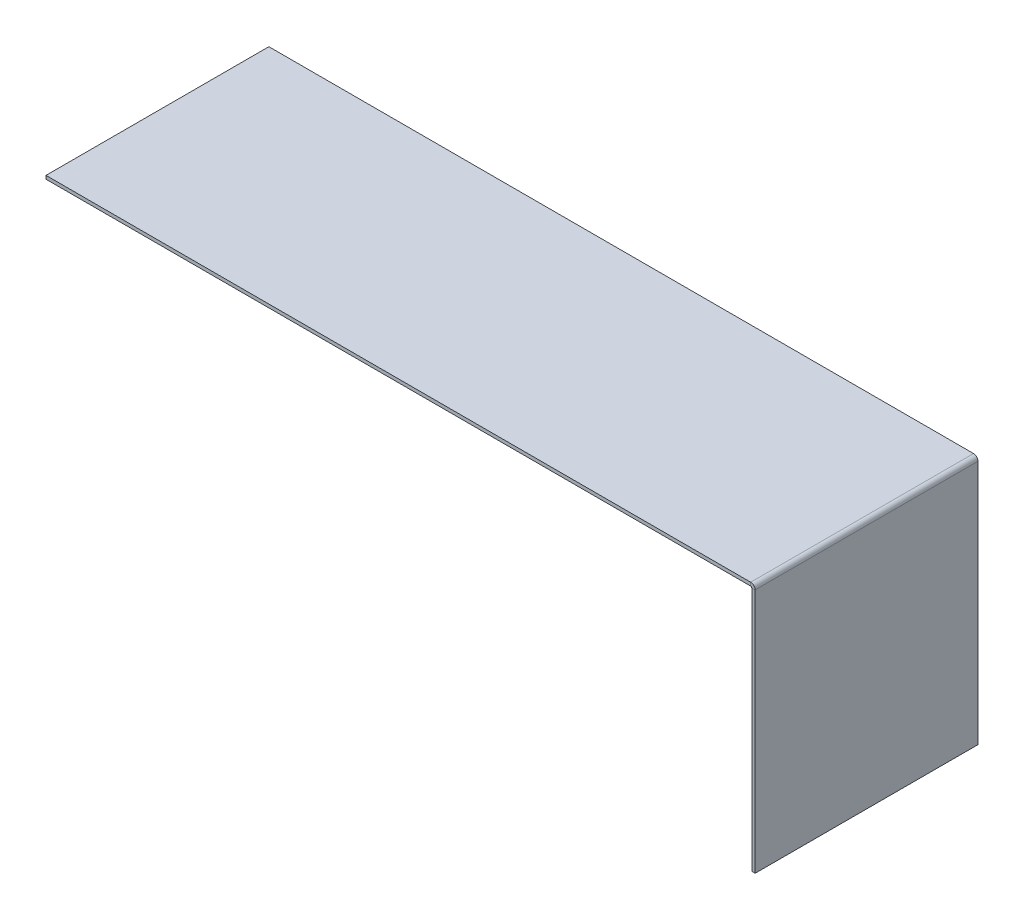
from build123d import *

# Parameters (mm, degrees)
BASE_FLANGE1_DEPTH = 209.55


# Sheet-metal steps are written as plain solids
with BuildPart() as part:
    # Sketch1 → Base-Flange1 (new body)
    with BuildSketch(Plane.XY):
        with BuildLine():
            Line((0, 0), (662.575, 0))
            ThreePointArc((662.575, 0), (665.527170811, -1.222829189), (666.75, -4.175))
            Line((666.75, -4.175), (666.75, -234.95))
            Line((666.75, -234.95), (663.575, -234.95))
            Line((663.575, -234.95), (663.575, -4.175))
            ThreePointArc((663.575, -4.175), (663.282106781, -3.467893219), (662.575, -3.175))
            Line((662.575, -3.175), (0, -3.175))
            Line((0, -3.175), (0, 0))
        make_face()
    extrude(amount=BASE_FLANGE1_DEPTH)


solid = part.part
